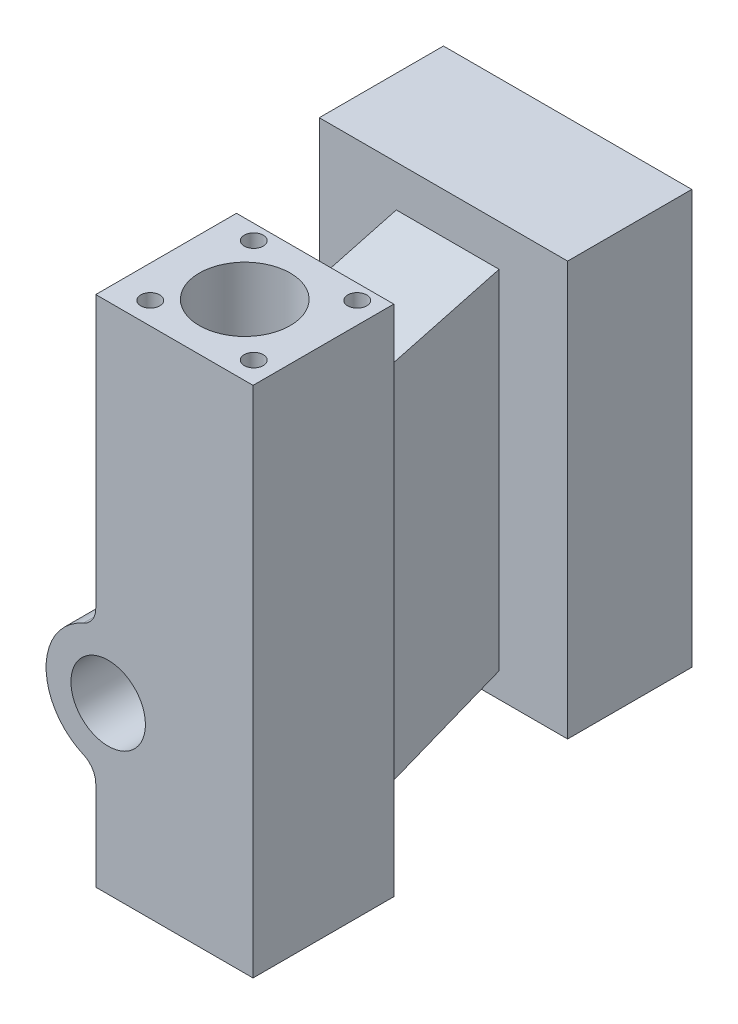
from build123d import *

# Parameters (mm, degrees)
SKETCH1_W            = 38
SKETCH1_H            = 124
BOSS_EXTRUDE1_DEPTH  = 34
SKETCH2_R            = 15
BOSS_EXTRUDE2_DEPTH  = 34
FILLET1_R            = 5
SKETCH3_R            = 11
CUT_EXTRUDE1_DEPTH   = 1000
SKETCH5_W            = 24.830906905
SKETCH5_H            = 111.203932215
BOSS_EXTRUDE3_DEPTH  = 30
SKETCH6_W            = 60
SKETCH6_H            = 100
BOSS_EXTRUDE4_DEPTH  = 30
CUT_EXTRUDE5_DEPTH   = 100
SKETCH10_R           = 7.5
CUT_EXTRUDE6_DEPTH   = 10
SKETCH11_R           = 2.301516645
CUT_EXTRUDE7_DEPTH   = 10
LPATTERN1_COUNT      = 2
LPATTERN1_PITCH      = 25
LPATTERN1_COUNT_DIR2 = 2
LPATTERN1_PITCH_DIR2 = 25
SKETCH4_R            = 9
CUT_EXTRUDE_1_DEPTH  = 17


with BuildPart() as part:
    # Sketch1 → Boss-Extrude1 (new body)
    with BuildSketch(Plane.XY):
        with Locations((-7.18125, -12.690625)):
            Rectangle(SKETCH1_W, SKETCH1_H)
    extrude(amount=BOSS_EXTRUDE1_DEPTH)

    # Sketch2 → Boss-Extrude2 (add)
    with BuildSketch(Plane.XY.offset(34)):
        with Locations((-23.18125, -34.690625)):
            Circle(SKETCH2_R)
    extrude(amount=-BOSS_EXTRUDE2_DEPTH)

    # Fillet1
    fillet1_edges = [part.edges().sort_by_distance(p)[0] for p in [
        (-26.18125, -49.387563457, 17),
        (-26.18125, -19.993686543, 17),
    ]]
    fillet(fillet1_edges, radius=FILLET1_R)

    # Sketch3 → Cut-Extrude1 (cut)
    with BuildSketch(Plane.XZ.offset(74.690625)):
        with Locations((-7.18125, 17)):
            Circle(SKETCH3_R)
    extrude(amount=-CUT_EXTRUDE1_DEPTH, mode=Mode.SUBTRACT)

    # Sketch5 → Boss-Extrude3 (add)
    with BuildSketch(Plane(origin=(0, 0, 0), x_dir=(-1, 0, 0), z_dir=(0, 0, -1))):
        with Locations((5.153648801, -6.911017359)):
            Rectangle(SKETCH5_W, SKETCH5_H)
    extrude(amount=BOSS_EXTRUDE3_DEPTH)

    # Sketch6 → Boss-Extrude4 (add)
    with BuildSketch(Plane(origin=(0, 0, -30), x_dir=(-1, 0, 0), z_dir=(0, 0, -1))):
        with Locations((6.18125, -0.690625)):
            Rectangle(SKETCH6_W, SKETCH6_H)
    extrude(amount=BOSS_EXTRUDE4_DEPTH)

    # Sketch9 → Cut-Extrude5 (cut)
    with BuildSketch(Plane(origin=(7.261804652, 0, 0), x_dir=(0, 0, -1), z_dir=(1, 0, 0))):
        Polygon((0, 52.602660234), (0, 31.309375), (30, 39.309375), (30, 52.602660234), align=None)
        Polygon((0, -56.690625), (0, -66.373805341), (30, -69.28142928), (30, -44.690625), align=None)
    extrude(amount=-CUT_EXTRUDE5_DEPTH, mode=Mode.SUBTRACT)

    # Sketch10 → Cut-Extrude6 (cut)
    with BuildSketch(Plane.ZY.offset(36.18125)):
        with Locations((-45, -15.690625)):
            Circle(SKETCH10_R)
    extrude(amount=-CUT_EXTRUDE6_DEPTH, mode=Mode.SUBTRACT)

    # Sketch11 → Cut-Extrude7 (cut)
    with BuildSketch(Plane(origin=(0, 49.309375, 0), x_dir=(1, 0, 0), z_dir=(0, 1, 0))):
        with Locations((6.624715973, -28.639015413)):
            Circle(SKETCH11_R)
    cut_extrude7 = extrude(amount=-CUT_EXTRUDE7_DEPTH, mode=Mode.SUBTRACT)

    # LPattern1: Cut-Extrude7 2 × 2
    with Locations(*[(-i * LPATTERN1_PITCH, 0, -j * LPATTERN1_PITCH_DIR2) for i in range(LPATTERN1_COUNT) for j in range(LPATTERN1_COUNT_DIR2) if (i, j) != (0, 0)]):
        add(cut_extrude7, mode=Mode.SUBTRACT)

    # Sketch4 → Вырез-Вытянуть1 (cut)
    with BuildSketch(Plane.XY.offset(34)):
        with Locations((-23.18125, -34.690625)):
            Circle(SKETCH4_R)
    extrude(amount=-CUT_EXTRUDE_1_DEPTH, mode=Mode.SUBTRACT)


solid = part.part
